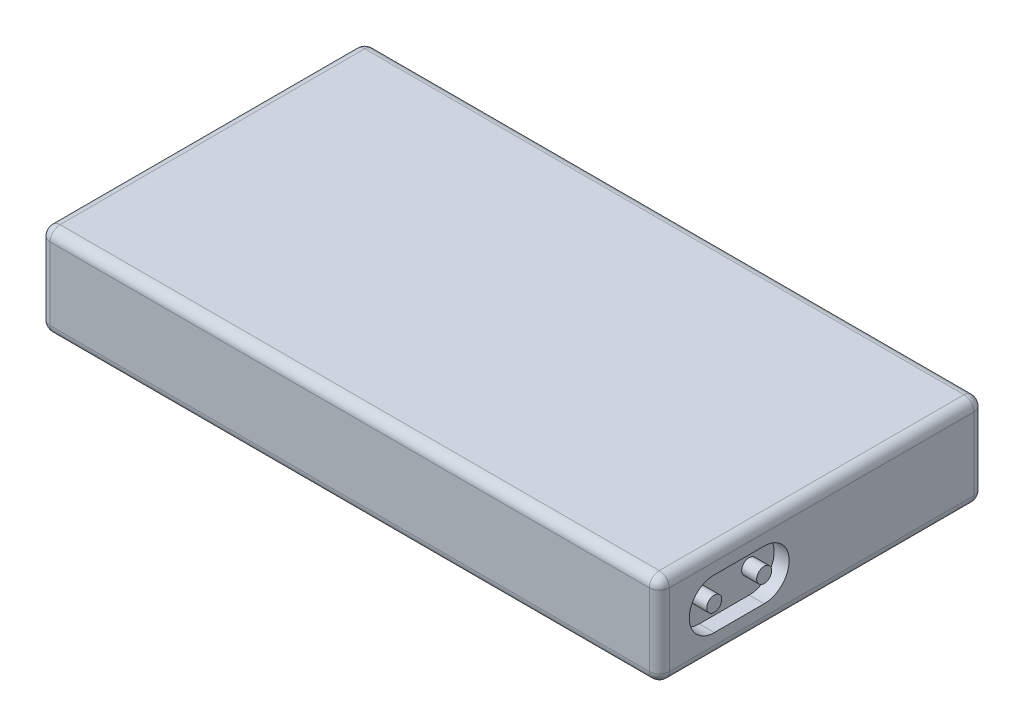
from build123d import *

# Parameters (mm, degrees)
SKETCH_1_W          = 124
SKETCH_1_H          = 65
EXTRUDE_1_DEPTH     = 18.5
SKETCH_2_R          = 1.5
CUT_EXTRUDE_1_DEPTH = 3
SKETCH_3_W          = 14
SKETCH_3_H          = 7
SKETCH_3_W_2        = 12
SKETCH_3_H_2        = 2
CUT_EXTRUDE_2_DEPTH = 3
SKETCH_4_R          = 0.5
CUT_EXTRUDE_3_DEPTH = 3
FILLET_1_R          = 2
FILLET_2_R          = 2
FILLET_3_R          = 2
FILLET_4_R          = 2


with BuildPart() as part:
    # Эскиз1 → Бобышка-Вытянуть1 (new body)
    with BuildSketch(Plane(origin=(0, 0, 0), x_dir=(1, 0, 0), z_dir=(0, 1, 0))):
        with Locations((62, 32.5)):
            Rectangle(SKETCH_1_W, SKETCH_1_H)
    extrude(amount=EXTRUDE_1_DEPTH)

    # Эскиз2 → Вырез-Вытянуть1 (cut)
    with BuildSketch(Plane(origin=(124, 0, 0), x_dir=(0, 0, -1), z_dir=(1, 0, 0))):
        with BuildLine():
            Line((11, 14.25), (21, 14.25))
            ThreePointArc((21, 14.25), (26, 9.25), (21, 4.25))
            Line((21, 4.25), (11, 4.25))
            ThreePointArc((11, 4.25), (6, 9.25), (11, 14.25))
        make_face()
        with Locations((11, 9.25)):
            Circle(SKETCH_2_R, mode=Mode.SUBTRACT)
        with Locations((21, 9.25)):
            Circle(SKETCH_2_R, mode=Mode.SUBTRACT)
    extrude(amount=-CUT_EXTRUDE_1_DEPTH, mode=Mode.SUBTRACT)

    # Эскиз3 → Вырез-Вытянуть2 (cut)
    with BuildSketch(Plane.ZY):
        with Locations((-52, 9.25)):
            Rectangle(SKETCH_3_W, SKETCH_3_H)
        with Locations((-52, 7.75)):
            Rectangle(SKETCH_3_W_2, SKETCH_3_H_2, mode=Mode.SUBTRACT)
    extrude(amount=-CUT_EXTRUDE_2_DEPTH, mode=Mode.SUBTRACT)

    # Эскиз4 → Вырез-Вытянуть3 (cut)
    with BuildSketch(Plane.ZY):
        Polygon((-19, 9.25), (-16, 12.25), (-10, 12.25), (-7, 9.25), (-10, 6.25), (-16, 6.25), align=None)
        with Locations((-16, 9.25)):
            Circle(SKETCH_4_R, mode=Mode.SUBTRACT)
        with Locations((-14, 9.25)):
            Circle(SKETCH_4_R, mode=Mode.SUBTRACT)
        with Locations((-12, 9.25)):
            Circle(SKETCH_4_R, mode=Mode.SUBTRACT)
        with Locations((-10, 9.25)):
            Circle(SKETCH_4_R, mode=Mode.SUBTRACT)
    extrude(amount=-CUT_EXTRUDE_3_DEPTH, mode=Mode.SUBTRACT)

    # Скругление1
    fillet_1_edges = [part.edges().sort_by_distance(p)[0] for p in [
        (124, 18.5, -32.5),
        (62, 18.5, -65),
        (0, 18.5, -32.5),
        (62, 18.5, 0),
    ]]
    fillet(fillet_1_edges, radius=FILLET_1_R)

    # Скругление2
    fillet_2_edges = [part.edges().sort_by_distance(p)[0] for p in [
        (62, 0, -65),
        (124, 0, -32.5),
        (62, 0, 0),
        (0, 0, -32.5),
    ]]
    fillet(fillet_2_edges, radius=FILLET_2_R)

    # Скругление3
    # the kernel refuses this fillet: 2 mm, written as the material it takes off along each edge
    with BuildSketch(Plane(origin=(2, 16.5, -2), x_dir=(-1, 0, 0), z_dir=(0, 0, 1))) as fillet_3_piece_1_section:
        Polygon((0, 0), (FILLET_3_R, 0), (FILLET_3_R, -FILLET_3_R), (0, -FILLET_3_R), align=None)
    fillet_3_piece_1 = extrude(amount=FILLET_3_R, mode=Mode.PRIVATE)
    fillet_3_piece_1 = fillet_3_piece_1 - Plane(origin=(2, 16.5, -2), x_dir=(0.7071067811865475, -0.7071067811865475, 0), z_dir=(0, 0, 1)) * Sphere(FILLET_3_R, mode=Mode.PRIVATE)
    add(fillet_3_piece_1, mode=Mode.SUBTRACT)
    with BuildSketch(Plane(origin=(122, 16.5, -2), x_dir=(1, 0, 0), z_dir=(0, 0, 1))) as fillet_3_piece_2_section:
        Polygon((0, 0), (FILLET_3_R, 0), (FILLET_3_R, FILLET_3_R), (0, FILLET_3_R), align=None)
    fillet_3_piece_2 = extrude(amount=FILLET_3_R, mode=Mode.PRIVATE)
    fillet_3_piece_2 = fillet_3_piece_2 - Plane(origin=(122, 16.5, -2), x_dir=(-0.7071067811865475, -0.7071067811865475, 0), z_dir=(0, 0, 1)) * Sphere(FILLET_3_R, mode=Mode.PRIVATE)
    add(fillet_3_piece_2, mode=Mode.SUBTRACT)
    with BuildSketch(Plane(origin=(2, 2, -2), x_dir=(-1, 0, 0), z_dir=(0, 0, 1))) as fillet_3_piece_3_section:
        Polygon((0, 0), (FILLET_3_R, 0), (FILLET_3_R, FILLET_3_R), (0, FILLET_3_R), align=None)
    fillet_3_piece_3 = extrude(amount=FILLET_3_R, mode=Mode.PRIVATE)
    fillet_3_piece_3 = fillet_3_piece_3 - Plane(origin=(2, 2, -2), x_dir=(0.7071067811865475, 0.7071067811865475, 0), z_dir=(0, 0, 1)) * Sphere(FILLET_3_R, mode=Mode.PRIVATE)
    add(fillet_3_piece_3, mode=Mode.SUBTRACT)
    with BuildSketch(Plane(origin=(122, 2, -2), x_dir=(1, 0, 0), z_dir=(0, 0, 1))) as fillet_3_piece_4_section:
        Polygon((0, 0), (FILLET_3_R, 0), (FILLET_3_R, -FILLET_3_R), (0, -FILLET_3_R), align=None)
    fillet_3_piece_4 = extrude(amount=FILLET_3_R, mode=Mode.PRIVATE)
    fillet_3_piece_4 = fillet_3_piece_4 - Plane(origin=(122, 2, -2), x_dir=(-0.7071067811865475, 0.7071067811865475, 0), z_dir=(0, 0, 1)) * Sphere(FILLET_3_R, mode=Mode.PRIVATE)
    add(fillet_3_piece_4, mode=Mode.SUBTRACT)
    with BuildSketch(Plane(origin=(124, 2, 0), x_dir=(-1, 0, 0), z_dir=(0, 1, 0))) as fillet_3_piece_5:
        with BuildLine():
            CenterArc((FILLET_3_R, -FILLET_3_R), FILLET_3_R, 90, 90)
            Line((0, -FILLET_3_R), (0, 0))
            Line((0, 0), (FILLET_3_R, 0))
        make_face()
    extrude(amount=14.5, mode=Mode.SUBTRACT)
    with BuildSketch(Plane(origin=(0, 2, 0), x_dir=(1, 0, 0), z_dir=(0, 1, 0))) as fillet_3_piece_6:
        with BuildLine():
            CenterArc((FILLET_3_R, FILLET_3_R), FILLET_3_R, 180, 90)
            Line((0, FILLET_3_R), (0, 0))
            Line((0, 0), (FILLET_3_R, 0))
        make_face()
    extrude(amount=14.5, mode=Mode.SUBTRACT)

    # Скругление4
    # the kernel refuses this fillet: 2 mm, written as the material it takes off along each edge
    with BuildSketch(Plane(origin=(2, 16.5, -63), x_dir=(0, 0, -1), z_dir=(-1, 0, 0))) as fillet_4_piece_1_section:
        Polygon((0, 0), (FILLET_4_R, 0), (FILLET_4_R, -FILLET_4_R), (0, -FILLET_4_R), align=None)
    fillet_4_piece_1 = extrude(amount=FILLET_4_R, mode=Mode.PRIVATE)
    fillet_4_piece_1 = fillet_4_piece_1 - Plane(origin=(2, 16.5, -63), x_dir=(0, -0.7071067811865475, 0.7071067811865475), z_dir=(-1, 0, 0)) * Sphere(FILLET_4_R, mode=Mode.PRIVATE)
    add(fillet_4_piece_1, mode=Mode.SUBTRACT)
    with BuildSketch(Plane(origin=(122, 16.5, -63), x_dir=(0, 0, -1), z_dir=(1, 0, 0))) as fillet_4_piece_2_section:
        Polygon((0, 0), (FILLET_4_R, 0), (FILLET_4_R, FILLET_4_R), (0, FILLET_4_R), align=None)
    fillet_4_piece_2 = extrude(amount=FILLET_4_R, mode=Mode.PRIVATE)
    fillet_4_piece_2 = fillet_4_piece_2 - Plane(origin=(122, 16.5, -63), x_dir=(0, -0.7071067811865475, 0.7071067811865475), z_dir=(1, 0, 0)) * Sphere(FILLET_4_R, mode=Mode.PRIVATE)
    add(fillet_4_piece_2, mode=Mode.SUBTRACT)
    with BuildSketch(Plane(origin=(2, 2, -63), x_dir=(0, 0, -1), z_dir=(-1, 0, 0))) as fillet_4_piece_3_section:
        Polygon((0, 0), (FILLET_4_R, 0), (FILLET_4_R, FILLET_4_R), (0, FILLET_4_R), align=None)
    fillet_4_piece_3 = extrude(amount=FILLET_4_R, mode=Mode.PRIVATE)
    fillet_4_piece_3 = fillet_4_piece_3 - Plane(origin=(2, 2, -63), x_dir=(0, 0.7071067811865475, 0.7071067811865475), z_dir=(-1, 0, 0)) * Sphere(FILLET_4_R, mode=Mode.PRIVATE)
    add(fillet_4_piece_3, mode=Mode.SUBTRACT)
    with BuildSketch(Plane(origin=(122, 2, -63), x_dir=(0, 0, -1), z_dir=(1, 0, 0))) as fillet_4_piece_4_section:
        Polygon((0, 0), (FILLET_4_R, 0), (FILLET_4_R, -FILLET_4_R), (0, -FILLET_4_R), align=None)
    fillet_4_piece_4 = extrude(amount=FILLET_4_R, mode=Mode.PRIVATE)
    fillet_4_piece_4 = fillet_4_piece_4 - Plane(origin=(122, 2, -63), x_dir=(0, 0.7071067811865475, 0.7071067811865475), z_dir=(1, 0, 0)) * Sphere(FILLET_4_R, mode=Mode.PRIVATE)
    add(fillet_4_piece_4, mode=Mode.SUBTRACT)
    with BuildSketch(Plane(origin=(124, 2, -65), x_dir=(0, 0, 1), z_dir=(0, 1, 0))) as fillet_4_piece_5:
        with BuildLine():
            CenterArc((FILLET_4_R, -FILLET_4_R), FILLET_4_R, 90, 90)
            Line((0, -FILLET_4_R), (0, 0))
            Line((0, 0), (FILLET_4_R, 0))
        make_face()
    extrude(amount=14.5, mode=Mode.SUBTRACT)
    with BuildSketch(Plane(origin=(0, 2, -65), x_dir=(0, 0, 1), z_dir=(0, 1, 0))) as fillet_4_piece_6:
        with BuildLine():
            CenterArc((FILLET_4_R, FILLET_4_R), FILLET_4_R, 180, 90)
            Line((0, FILLET_4_R), (0, 0))
            Line((0, 0), (FILLET_4_R, 0))
        make_face()
    extrude(amount=14.5, mode=Mode.SUBTRACT)


solid = part.part
